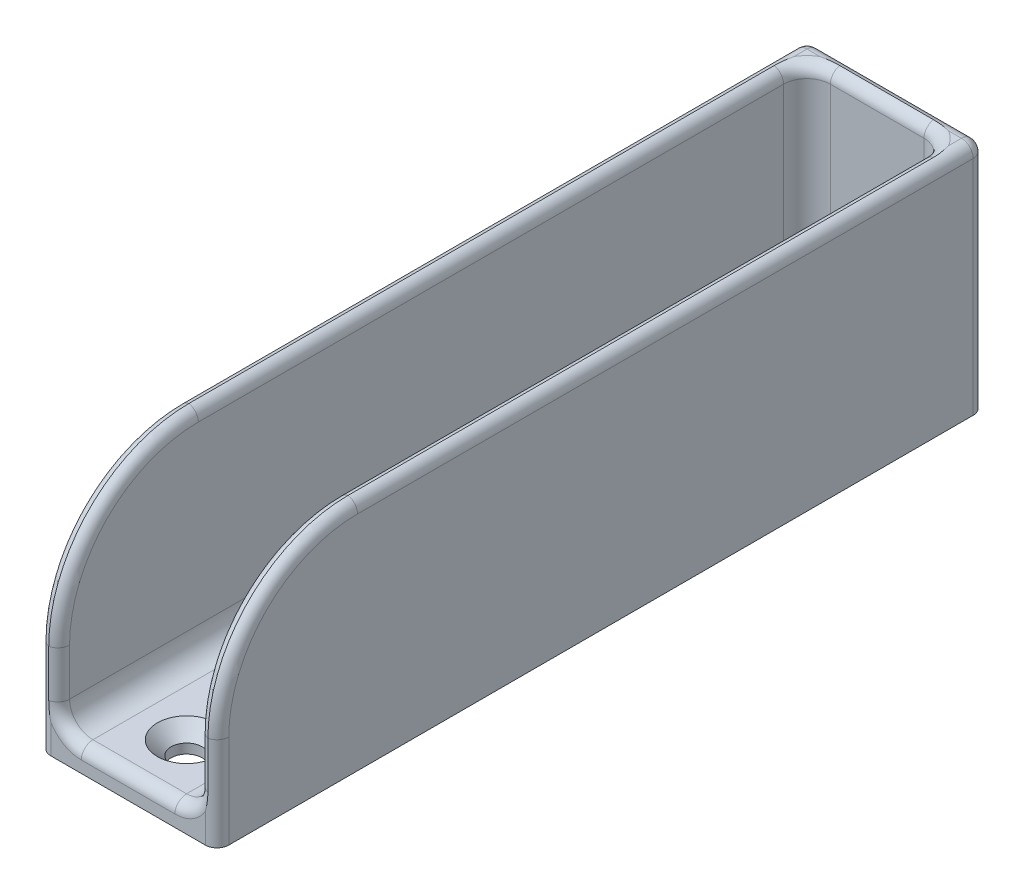
from build123d import *

# Parameters (mm, degrees)
SKETCH1_W           = 19.05
SKETCH1_H           = 101.6
BOSS_EXTRUDE1_DEPTH = 3.175
BOSS_EXTRUDE2_DEPTH = 31.75
FILLET1_R           = 19.05
FILLET2_R           = 3.175
FILLET3_R           = 1.5875
SKETCH3_R           = 2.0955
CUT_EXTRUDE1_DEPTH  = 62.702921072


with BuildPart() as part:
    # Sketch1 → Boss-Extrude1 (new body)
    with BuildSketch(Plane(origin=(0, 0, 0), x_dir=(1, 0, 0), z_dir=(0, 1, 0))):
        Rectangle(SKETCH1_W, SKETCH1_H)
    extrude(amount=BOSS_EXTRUDE1_DEPTH)

    # Sketch2 → Boss-Extrude2 (add)
    with BuildSketch(Plane(origin=(0, 0, 0), x_dir=(1, 0, 0), z_dir=(0, 1, 0))):
        Polygon((-12.065, 53.34), (-12.065, -50.8), (-9.525, -50.8), (-9.525, 50.8), (9.525, 50.8), (9.525, -50.8), (12.065, -50.8), (12.065, 53.34), align=None)
    extrude(amount=BOSS_EXTRUDE2_DEPTH)

    # Fillet1
    fillet1_edges = [part.edges().sort_by_distance(p)[0] for p in [
        (10.795, 31.75, 50.8),
        (-10.795, 31.75, 50.8),
    ]]
    fillet(fillet1_edges, radius=FILLET1_R)

    # Fillet2
    fillet2_edges = [part.edges().sort_by_distance(p)[0] for p in [
        (-9.525, 3.175, 0),
        (-9.525, 17.4625, -50.8),
        (9.525, 17.4625, -50.8),
        (9.525, 3.175, 0),
        (0, 3.175, -50.8),
    ]]
    fillet(fillet2_edges, radius=FILLET2_R)

    # Fillet3
    # the kernel refuses this fillet: 1.5875 mm, written as the material it takes off along each edge
    with BuildSketch(Plane(origin=(-10.4775, 30.1625, -51.7525), x_dir=(-1, 0, 0), z_dir=(0, 1, 0))) as fillet3_piece_1_section:
        Polygon((0, 0), (FILLET3_R, 0), (FILLET3_R, -FILLET3_R), (0, -FILLET3_R), align=None)
    fillet3_piece_1 = extrude(amount=FILLET3_R, mode=Mode.PRIVATE)
    fillet3_piece_1 = fillet3_piece_1 - Plane(origin=(-10.4775, 30.1625, -51.7525), x_dir=(0.7071067811865475, 0, 0.7071067811865475), z_dir=(0, 1, 0)) * Sphere(FILLET3_R, mode=Mode.PRIVATE)
    add(fillet3_piece_1, mode=Mode.SUBTRACT)
    with BuildSketch(Plane(origin=(10.4775, 30.1625, -51.7525), x_dir=(0, 1, 0), z_dir=(1, 0, 0))) as fillet3_piece_2_section:
        Polygon((0, 0), (FILLET3_R, 0), (FILLET3_R, -FILLET3_R), (0, -FILLET3_R), align=None)
    fillet3_piece_2 = extrude(amount=FILLET3_R, mode=Mode.PRIVATE)
    fillet3_piece_2 = fillet3_piece_2 - Plane(origin=(10.4775, 30.1625, -51.7525), x_dir=(0, -0.7071067811865475, 0.7071067811865475), z_dir=(1, 0, 0)) * Sphere(FILLET3_R, mode=Mode.PRIVATE)
    add(fillet3_piece_2, mode=Mode.SUBTRACT)
    with BuildSketch(Plane(origin=(12.065, 12.7, 31.75), x_dir=(0, 0, 1), z_dir=(0, -1, 0))) as fillet3_piece_3:
        with BuildLine():
            CenterArc((19.05 - FILLET3_R, FILLET3_R), FILLET3_R, 270, 90)
            Line((19.05, FILLET3_R), (19.05, 0))
            Line((19.05, 0), (19.05 - FILLET3_R, 0))
        make_face()
    revolve(axis=Axis((12.065, 12.7, 31.75), (-1, 0, 0)), revolution_arc=90, mode=Mode.SUBTRACT)
    with BuildSketch(Plane(origin=(-12.065, 12.7, 31.75), x_dir=(0, 0, 1), z_dir=(0, -1, 0))) as fillet3_piece_4:
        with BuildLine():
            CenterArc((19.05 - FILLET3_R, -FILLET3_R), FILLET3_R, 0, 90)
            Line((19.05 - FILLET3_R, 0), (19.05, 0))
            Line((19.05, 0), (19.05, -FILLET3_R))
        make_face()
    revolve(axis=Axis((-12.065, 12.7, 31.75), (-1, 0, 0)), revolution_arc=90, mode=Mode.SUBTRACT)
    with BuildSketch(Plane(origin=(-9.525, 12.7, 31.75), x_dir=(0, 0, 1), z_dir=(0, -1, 0))) as fillet3_piece_5:
        with BuildLine():
            CenterArc((19.05 - FILLET3_R, FILLET3_R), FILLET3_R, 270, 90)
            Line((19.05, FILLET3_R), (19.05, 0))
            Line((19.05, 0), (19.05 - FILLET3_R, 0))
        make_face()
    revolve(axis=Axis((-9.525, 12.7, 31.75), (-1, 0, 0)), revolution_arc=90, mode=Mode.SUBTRACT)
    with BuildSketch(Plane(origin=(9.525, 12.7, 31.75), x_dir=(0, 0, 1), z_dir=(0, -1, 0))) as fillet3_piece_6:
        with BuildLine():
            CenterArc((19.05 - FILLET3_R, -FILLET3_R), FILLET3_R, 0, 90)
            Line((19.05, -FILLET3_R), (19.05, 0))
            Line((19.05, 0), (19.05 - FILLET3_R, 0))
        make_face()
    revolve(axis=Axis((9.525, 12.7, 31.75), (-1, 0, 0)), revolution_arc=90, mode=Mode.SUBTRACT)
    with BuildSketch(Plane(origin=(9.525, 6.35, 50.8), x_dir=(1, 0, 0), z_dir=(0, 1, 0))) as fillet3_piece_7:
        with BuildLine():
            CenterArc((FILLET3_R, FILLET3_R), FILLET3_R, 180, 90)
            Line((0, FILLET3_R), (0, 0))
            Line((0, 0), (FILLET3_R, 0))
        make_face()
    extrude(amount=6.35, mode=Mode.SUBTRACT)
    with BuildSketch(Plane(origin=(6.35, 6.35, 50.8), x_dir=(0, -1, 0), z_dir=(-1, 0, 0))) as fillet3_piece_8:
        with BuildLine():
            CenterArc((3.175 + FILLET3_R, -FILLET3_R), FILLET3_R, 90, 90)
            Line((3.175, -FILLET3_R), (3.175, 0))
            Line((3.175, 0), (3.175 + FILLET3_R, 0))
        make_face()
    revolve(axis=Axis((6.35, 6.35, 50.8), (0, 0, 1)), revolution_arc=90, mode=Mode.SUBTRACT)
    with BuildSketch(Plane(origin=(-6.35, 3.175, 50.8), x_dir=(0, -1, 0), z_dir=(1, 0, 0))) as fillet3_piece_9:
        with BuildLine():
            CenterArc((FILLET3_R, FILLET3_R), FILLET3_R, 180, 90)
            Line((0, FILLET3_R), (0, 0))
            Line((0, 0), (FILLET3_R, 0))
        make_face()
    extrude(amount=12.7, mode=Mode.SUBTRACT)
    with BuildSketch(Plane(origin=(-6.35, 6.35, 50.8), x_dir=(-1, 0, 0), z_dir=(0, 1, 0))) as fillet3_piece_10:
        with BuildLine():
            CenterArc((3.175 + FILLET3_R, -FILLET3_R), FILLET3_R, 90, 90)
            Line((3.175, -FILLET3_R), (3.175, 0))
            Line((3.175, 0), (3.175 + FILLET3_R, 0))
        make_face()
    revolve(axis=Axis((-6.35, 6.35, 50.8), (0, 0, 1)), revolution_arc=90, mode=Mode.SUBTRACT)
    with BuildSketch(Plane(origin=(-6.35, 31.75, -47.625), x_dir=(-1, 0, 0), z_dir=(0, 0, 1))) as fillet3_piece_11:
        with BuildLine():
            CenterArc((3.175 + FILLET3_R, FILLET3_R), FILLET3_R, 180, 90)
            Line((3.175, FILLET3_R), (3.175, 0))
            Line((3.175, 0), (3.175 + FILLET3_R, 0))
        make_face()
    revolve(axis=Axis((-6.35, 31.75, -47.625), (0, -1, 0)), revolution_arc=90, mode=Mode.SUBTRACT)
    with BuildSketch(Plane(origin=(-9.525, 31.75, 31.75), x_dir=(0, -1, 0), z_dir=(0, 0, -1)), Plane(origin=(9.525, 31.75, -47.625), x_dir=(0, -1, 0), z_dir=(0, 0, 1))) as fillet3_piece_12:
        with BuildLine():
            CenterArc((FILLET3_R, FILLET3_R), FILLET3_R, 180, 90)
            Line((0, FILLET3_R), (0, 0))
            Line((0, 0), (FILLET3_R, 0))
        make_face()
    extrude(amount=79.375, mode=Mode.SUBTRACT)
    with BuildSketch(Plane(origin=(-12.065, 31.75, -51.7525), x_dir=(0, -1, 0), z_dir=(0, 0, 1)), Plane(origin=(12.065, 31.75, 31.75), x_dir=(0, -1, 0), z_dir=(0, 0, -1))) as fillet3_piece_13:
        with BuildLine():
            CenterArc((FILLET3_R, FILLET3_R), FILLET3_R, 180, 90)
            Line((0, FILLET3_R), (0, 0))
            Line((0, 0), (FILLET3_R, 0))
        make_face()
    extrude(amount=83.5025, mode=Mode.SUBTRACT)
    with BuildSketch(Plane(origin=(10.4775, 31.75, -53.34), x_dir=(0, 0, 1), z_dir=(-1, 0, 0))) as fillet3_piece_14:
        with BuildLine():
            CenterArc((FILLET3_R, -FILLET3_R), FILLET3_R, 90, 90)
            Line((0, -FILLET3_R), (0, 0))
            Line((0, 0), (FILLET3_R, 0))
        make_face()
    extrude(amount=20.955, mode=Mode.SUBTRACT)
    with BuildSketch(Plane(origin=(6.35, 31.75, -47.625), x_dir=(1, 0, 0), z_dir=(0, 0, 1))) as fillet3_piece_15:
        with BuildLine():
            CenterArc((3.175 + FILLET3_R, -FILLET3_R), FILLET3_R, 90, 90)
            Line((3.175, -FILLET3_R), (3.175, 0))
            Line((3.175, 0), (3.175 + FILLET3_R, 0))
        make_face()
    revolve(axis=Axis((6.35, 31.75, -47.625), (0, 1, 0)), revolution_arc=90, mode=Mode.SUBTRACT)
    with BuildSketch(Plane(origin=(-6.35, 31.75, -50.8), x_dir=(0, 0, -1), z_dir=(1, 0, 0))) as fillet3_piece_16:
        with BuildLine():
            CenterArc((FILLET3_R, -FILLET3_R), FILLET3_R, 90, 90)
            Line((0, -FILLET3_R), (0, 0))
            Line((0, 0), (FILLET3_R, 0))
        make_face()
    extrude(amount=12.7, mode=Mode.SUBTRACT)
    with BuildSketch(Plane(origin=(-12.065, -3.96875, -53.34), x_dir=(0, 0, 1), z_dir=(0, 1, 0))) as fillet3_piece_17:
        with BuildLine():
            CenterArc((FILLET3_R, FILLET3_R), FILLET3_R, 180, 90)
            Line((0, FILLET3_R), (0, 0))
            Line((0, 0), (FILLET3_R, 0))
        make_face()
    extrude(amount=34.13125, mode=Mode.SUBTRACT)
    with BuildSketch(Plane(origin=(12.065, -3.96875, -53.34), x_dir=(0, 0, 1), z_dir=(0, 1, 0))) as fillet3_piece_18:
        with BuildLine():
            CenterArc((FILLET3_R, -FILLET3_R), FILLET3_R, 90, 90)
            Line((0, -FILLET3_R), (0, 0))
            Line((0, 0), (FILLET3_R, 0))
        make_face()
    extrude(amount=34.13125, mode=Mode.SUBTRACT)
    with BuildSketch(Plane(origin=(12.065, -3.96875, 50.8), x_dir=(-1, 0, 0), z_dir=(0, 1, 0))) as fillet3_piece_19:
        with BuildLine():
            CenterArc((FILLET3_R, -FILLET3_R), FILLET3_R, 90, 90)
            Line((0, -FILLET3_R), (0, 0))
            Line((0, 0), (FILLET3_R, 0))
        make_face()
    extrude(amount=16.66875, mode=Mode.SUBTRACT)
    with BuildSketch(Plane(origin=(-12.065, -3.96875, 50.8), x_dir=(1, 0, 0), z_dir=(0, 1, 0))) as fillet3_piece_20:
        with BuildLine():
            CenterArc((FILLET3_R, FILLET3_R), FILLET3_R, 180, 90)
            Line((0, FILLET3_R), (0, 0))
            Line((0, 0), (FILLET3_R, 0))
        make_face()
    extrude(amount=16.66875, mode=Mode.SUBTRACT)
    with BuildSketch(Plane(origin=(-9.525, 6.35, 50.8), x_dir=(-1, 0, 0), z_dir=(0, 1, 0))) as fillet3_piece_21:
        with BuildLine():
            CenterArc((FILLET3_R, -FILLET3_R), FILLET3_R, 90, 90)
            Line((0, -FILLET3_R), (0, 0))
            Line((0, 0), (FILLET3_R, 0))
        make_face()
    extrude(amount=6.35, mode=Mode.SUBTRACT)

    # Sketch3 → Cut-Extrude1 (cut, through all)
    with BuildSketch(Plane(origin=(0, 3.175, 0), x_dir=(1, 0, 0), z_dir=(0, 1, 0))):
        with Locations(Location((0, 41.275, 0), (0, 0, 270))):
            Circle(SKETCH3_R)
        with Locations(Location((0, -42.8625, 0), (0, 0, 270))):
            Circle(SKETCH3_R)
    extrude(amount=-CUT_EXTRUDE1_DEPTH, mode=Mode.SUBTRACT)

    # Cut-Extrude2 cone 1 section (through the dimple's axis) → Cut-Extrude2 (revolve, cut)
    with BuildSketch(Plane(origin=(0, 3.175, -41.275), x_dir=(0, 0, 1), z_dir=(1, 0, 0))):
        Polygon((0, 0), (3.96875, 0), (0, 3.96875), align=None)
    revolve(axis=Axis((0, 3.175, -41.275), (0, -1, 0)), mode=Mode.SUBTRACT)

    # Cut-Extrude2 cone 2 section (through the dimple's axis) → Cut-Extrude2 cone 2 (revolve, cut)
    with BuildSketch(Plane(origin=(0, 3.175, 42.8625), x_dir=(0, 0, 1), z_dir=(1, 0, 0))):
        Polygon((0, 0), (3.96875, 0), (0, 3.96875), align=None)
    revolve(axis=Axis((0, 3.175, 42.8625), (0, -1, 0)), mode=Mode.SUBTRACT)


solid = part.part
